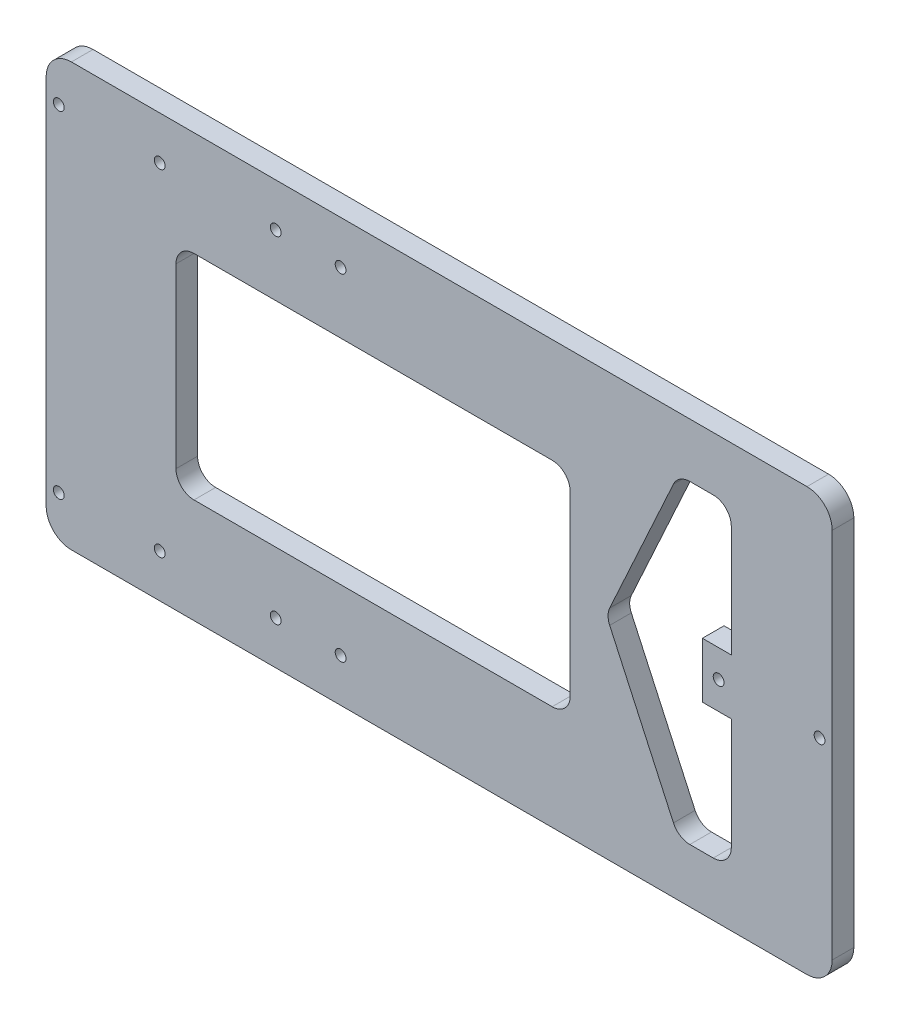
from build123d import *

# Parameters (mm, degrees)
SKETCH1_W           = 218
SKETCH1_H           = 117.2
SKETCH1_R           = 1.5
BOSS_EXTRUDE1_DEPTH = 6
SKETCH2_R           = 1.5
CUT_EXTRUDE1_DEPTH  = 6
FILLET1_R           = 7
SKETCH3_W           = 109.333333333
SKETCH3_H           = 59.2
CUT_EXTRUDE2_DEPTH  = 10
FILLET3_R           = 5
CUT_EXTRUDE3_DEPTH  = 10
FILLET4_R           = 5


with BuildPart() as part:
    # Sketch1 → Boss-Extrude1 (new body)
    with BuildSketch(Plane.XY):
        with Locations((-150.609177744, 197.743600407)):
            Rectangle(SKETCH1_W, SKETCH1_H)
        with Locations((-256.109177744, 151.143600407)):
            Circle(SKETCH1_R, mode=Mode.SUBTRACT)
        with Locations((-228.109177744, 151.143600407)):
            Circle(SKETCH1_R, mode=Mode.SUBTRACT)
        with Locations((-73.109177744, 197.743600407)):
            Circle(SKETCH1_R, mode=Mode.SUBTRACT)
        with Locations((-45.109177744, 197.743600407)):
            Circle(SKETCH1_R, mode=Mode.SUBTRACT)
        with Locations((-256.109177744, 244.343600407)):
            Circle(SKETCH1_R, mode=Mode.SUBTRACT)
        with Locations((-228.109177744, 244.343600407)):
            Circle(SKETCH1_R, mode=Mode.SUBTRACT)
    extrude(amount=BOSS_EXTRUDE1_DEPTH)

    # Sketch2 → Cut-Extrude1 (cut)
    with BuildSketch(Plane.XY.offset(6)):
        with Locations((-195.942511077, 151.143600407)):
            Circle(SKETCH2_R)
        with Locations((-177.942511077, 151.143600407)):
            Circle(SKETCH2_R)
        with Locations((-195.942511077, 244.343600407)):
            Circle(SKETCH2_R)
        with Locations((-177.942511077, 244.343600407)):
            Circle(SKETCH2_R)
    extrude(amount=-CUT_EXTRUDE1_DEPTH, mode=Mode.SUBTRACT)

    # Fillet1
    fillet1_edges = [part.edges().sort_by_distance(p)[0] for p in [
        (-41.609177744, 139.143600407, 3),
        (-41.609177744, 256.343600407, 3),
        (-259.609177744, 139.143600407, 3),
        (-259.609177744, 256.343600407, 3),
    ]]
    fillet(fillet1_edges, radius=FILLET1_R)

    # Sketch3 → Cut-Extrude2 (cut)
    with BuildSketch(Plane(origin=(0, 0, 0), x_dir=(-1, 0, 0), z_dir=(0, 0, -1))):
        with Locations((168.942511078, 197.743600407)):
            Rectangle(SKETCH3_W, SKETCH3_H)
    extrude(amount=-CUT_EXTRUDE2_DEPTH, mode=Mode.SUBTRACT)

    # Fillet3
    fillet3_edges = [part.edges().sort_by_distance(p)[0] for p in [
        (-114.275844411, 168.143600407, 3),
        (-223.609177744, 168.143600407, 3),
        (-223.609177744, 227.343600407, 3),
        (-114.275844411, 227.343600407, 3),
    ]]
    fillet(fillet3_edges, radius=FILLET3_R)

    # Sketch4 → Cut-Extrude3 (cut)
    with BuildSketch(Plane(origin=(0, 0, 0), x_dir=(-1, 0, 0), z_dir=(0, 0, -1))):
        Polygon((84.298987117, 241.343600407), (69.597266226, 241.343600407), (69.597266226, 205.418600407), (77.609177744, 205.418600407), (77.609177744, 190.068600407), (69.597266226, 190.068600407), (69.597266226, 154.143600407), (84.298987117, 154.143600407), (104.275844411, 197.743600407), align=None)
    extrude(amount=-CUT_EXTRUDE3_DEPTH, mode=Mode.SUBTRACT)

    # Fillet4
    fillet4_edges = [part.edges().sort_by_distance(p)[0] for p in [
        (-69.597266226, 154.143600407, 3),
        (-84.298987117, 154.143600407, 3),
        (-104.275844411, 197.743600407, 3),
        (-84.298987117, 241.343600407, 3),
        (-69.597266226, 241.343600407, 3),
    ]]
    fillet(fillet4_edges, radius=FILLET4_R)


solid = part.part
